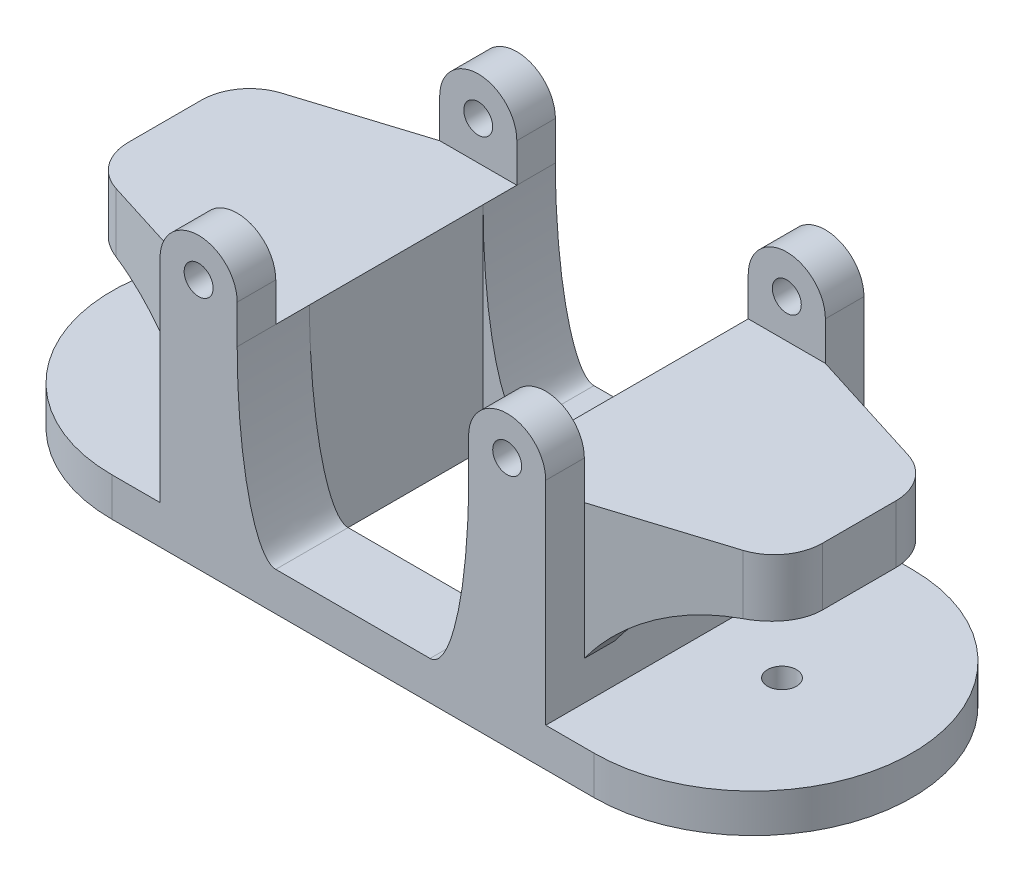
from build123d import *

# Parameters (mm, degrees)
SKETCH1_W                      = 32
SKETCH1_H                      = 33
BOSS_EXTRUDE1_DEPTH            = 18
SHELL1_T                       = -4
SKETCH2_R                      = 1.5
BOSS_EXTRUDE2_DEPTH            = 16.5
CUT_EXTRUDE5_REACH             = 46.41
SKETCH10_W                     = 25
SKETCH10_H                     = 8
CUT_EXTRUDE5_DIRECTION_2_REACH = 46.41
BOSS_EXTRUDE3_DEPTH            = 14
CUT_EXTRUDE6_DEPTH             = 10
CUT_EXTRUDE7_REACH             = 57.326
SKETCH15_R                     = 1.5
BOSS_EXTRUDE5_DEPTH            = 4
SKETCH9_W                      = 24
SKETCH9_H                      = 18
CUT_EXTRUDE4_DEPTH             = 50.784535752
SKETCH16_W                     = 24
SKETCH16_H                     = 18
CUT_EXTRUDE8_DEPTH             = 60.052942348
FILLET1_SIZE                   = 4
FILLET1_SIZE_2                 = 18
FILLET2_SIZE                   = 4
FILLET2_SIZE_2                 = 18


with BuildPart() as part:
    # Sketch1 → Boss-Extrude1 (new body)
    with BuildSketch(Plane(origin=(0, 0, 0), x_dir=(1, 0, 0), z_dir=(0, 1, 0))):
        Rectangle(SKETCH1_W, SKETCH1_H)
    extrude(amount=BOSS_EXTRUDE1_DEPTH)

    # Shell1
    shell1_openings = [part.faces().sort_by_distance(p)[0] for p in [
        (0, 18, 0),
    ]]
    offset(amount=SHELL1_T, openings=shell1_openings, kind=Kind.INTERSECTION)

    # Sketch2 → Boss-Extrude2 (add, symmetric)
    # profile 1 of 2: a face of its own
    with BuildSketch(Plane.XY):
        with BuildLine():
            Line((-16, 0), (-20, 0))
            Line((-20, 0), (-20, 22))
            ThreePointArc((-20, 22), (-16, 26), (-12, 22))
            Line((-12, 22), (-12, 18))
            Line((-12, 18), (-16, 18))
            Line((-16, 18), (-16, 0))
        make_face()
        with Locations((-16, 22)):
            Circle(SKETCH2_R, mode=Mode.SUBTRACT)
    # profile 2 of 2: a face of its own
    with BuildSketch(Plane.XY):
        with BuildLine():
            Line((16, 18), (16, 0))
            Line((16, 0), (20, 0))
            Line((20, 0), (20, 22))
            ThreePointArc((20, 22), (16, 26), (12, 22))
            Line((12, 22), (12, 18))
            Line((12, 18), (16, 18))
        make_face()
        with Locations(Location((16, 22, 0), (0, 0, 180))):
            Circle(SKETCH2_R, mode=Mode.SUBTRACT)
    extrude(amount=BOSS_EXTRUDE2_DEPTH, both=True)

    # Sketch10 → Cut-Extrude5 (cut, up to next)
    with BuildSketch(Plane(origin=(-12, 0, 0), x_dir=(0, 0, -1), z_dir=(1, 0, 0)), mode=Mode.PRIVATE) as cut_extrude5_sk1:
        with Locations((0, 22)):
            Rectangle(SKETCH10_W, SKETCH10_H)
    cut_extrude5_tool1 = extrude(cut_extrude5_sk1.sketch, amount=-CUT_EXTRUDE5_REACH, mode=Mode.PRIVATE) & part.part
    add(cut_extrude5_tool1.solids().sort_by_distance((-12, 22, 0))[0], mode=Mode.SUBTRACT)

    # Sketch10 → Cut-Extrude5 direction 2 (cut, up to next)
    with BuildSketch(Plane(origin=(-12, 0, 0), x_dir=(0, 0, -1), z_dir=(1, 0, 0)), mode=Mode.PRIVATE) as cut_extrude5_direction_2_sk1:
        with Locations((0, 22)):
            Rectangle(SKETCH10_W, SKETCH10_H)
    cut_extrude5_direction_2_tool1 = extrude(cut_extrude5_direction_2_sk1.sketch, amount=CUT_EXTRUDE5_DIRECTION_2_REACH, mode=Mode.PRIVATE) & part.part
    add(cut_extrude5_direction_2_tool1.solids().sort_by_distance((-12, 22, 0))[0], mode=Mode.SUBTRACT)

    # Sketch11 → Boss-Extrude3 (add)
    with BuildSketch(Plane(origin=(0, 18, 0), x_dir=(1, 0, 0), z_dir=(0, 1, 0))):
        with BuildLine():
            Line((-20, 12.5), (-32.5, 8.568931862))
            ThreePointArc((-32.5, 8.568931862), (-35.031128874, 6.757275747), (-36, 3.799235855))
            Line((-36, 3.799235855), (-36, -3.799235855))
            ThreePointArc((-36, -3.799235855), (-35.031128874, -6.757275747), (-32.5, -8.568931862))
            Line((-32.5, -8.568931862), (-20, -12.5))
            Line((-20, -12.5), (-20, 12.5))
        make_face()
        with BuildLine():
            Line((32.5, -8.568931862), (20, -12.5))
            Line((20, -12.5), (20, 12.5))
            Line((20, 12.5), (32.5, 8.568931862))
            ThreePointArc((32.5, 8.568931862), (35.031128874, 6.757275747), (36, 3.799235855))
            Line((36, 3.799235855), (36, -3.799235855))
            ThreePointArc((36, -3.799235855), (35.031128874, -6.757275747), (32.5, -8.568931862))
        make_face()
    extrude(amount=-BOSS_EXTRUDE3_DEPTH)

    # Sketch12 → Cut-Extrude6 (cut)
    with BuildSketch(Plane.XZ.offset(-4)):
        with BuildLine():
            Line((-20, -9.35514549), (-20, 9.35514549))
            Line((-20, 9.35514549), (-31.6, 5.707114258))
            ThreePointArc((-31.6, 5.707114258), (-32.61245155, 4.982451812), (-33, 3.799235855))
            Line((-33, 3.799235855), (-33, -3.799235855))
            ThreePointArc((-33, -3.799235855), (-32.61245155, -4.982451812), (-31.6, -5.707114258))
            Line((-31.6, -5.707114258), (-20, -9.35514549))
        make_face()
        with BuildLine():
            Line((31.6, -5.707114258), (20, -9.35514549))
            Line((20, -9.35514549), (20, 9.35514549))
            Line((20, 9.35514549), (31.6, 5.707114258))
            ThreePointArc((31.6, 5.707114258), (32.61245155, 4.982451812), (33, 3.799235855))
            Line((33, 3.799235855), (33, -3.799235855))
            ThreePointArc((33, -3.799235855), (32.61245155, -4.982451812), (31.6, -5.707114258))
        make_face()
    extrude(amount=-CUT_EXTRUDE6_DEPTH, mode=Mode.SUBTRACT)

    # Sketch13 → Cut-Extrude7 (cut, up to next)
    with BuildSketch(Plane.XY.offset(16.5), mode=Mode.PRIVATE) as cut_extrude7_sk1:
        with BuildLine():
            Line((-36, 12), (-36, 4))
            Line((-36, 4), (-20, 4))
            ThreePointArc((-20, 4), (-26.93585496, 10.128290081), (-36, 12))
        make_face()
    cut_extrude7_tool1 = extrude(cut_extrude7_sk1.sketch, amount=-CUT_EXTRUDE7_REACH, mode=Mode.PRIVATE) & part.part
    # Sketch13 → Cut-Extrude7 (cut, up to next)
    with BuildSketch(Plane.XY.offset(16.5), mode=Mode.PRIVATE) as cut_extrude7_sk2:
        with BuildLine():
            Line((36, 4), (20, 4))
            ThreePointArc((20, 4), (26.93585496, 10.128290081), (36, 12))
            Line((36, 12), (36, 4))
        make_face()
    cut_extrude7_tool2 = extrude(cut_extrude7_sk2.sketch, amount=-CUT_EXTRUDE7_REACH, mode=Mode.PRIVATE) & part.part
    add(cut_extrude7_tool1.solids().sort_by_distance((-29.706779, 7.345809, 16.5))[0], mode=Mode.SUBTRACT)
    add(cut_extrude7_tool2.solids().sort_by_distance((29.706779, 7.345809, 16.5))[0], mode=Mode.SUBTRACT)

    # Sketch15 → Boss-Extrude5 (add)
    with BuildSketch(Plane.XZ):
        with BuildLine():
            Line((-25, 16.5), (25, 16.5))
            ThreePointArc((25, 16.5), (41.5, 0), (25, -16.5))
            Line((25, -16.5), (-25, -16.5))
            ThreePointArc((-25, -16.5), (-41.5, 0), (-25, 16.5))
        make_face()
        with Locations(Location((-28, 0, 0), (0, 0, 270))):
            Circle(SKETCH15_R, mode=Mode.SUBTRACT)
        with Locations(Location((28, 0, 0), (0, 0, 90))):
            Circle(SKETCH15_R, mode=Mode.SUBTRACT)
    extrude(amount=BOSS_EXTRUDE5_DEPTH)

    # Sketch9 → Cut-Extrude4 (cut, through all)
    with BuildSketch(Plane(origin=(0, 4, 0), x_dir=(1, 0, 0), z_dir=(0, 1, 0))):
        Rectangle(SKETCH9_W, SKETCH9_H)
    extrude(amount=-CUT_EXTRUDE4_DEPTH, mode=Mode.SUBTRACT)

    # Sketch16 → Cut-Extrude8 (cut, through all)
    with BuildSketch(Plane.XY.offset(16.5)):
        with Locations((0, 9)):
            Rectangle(SKETCH16_W, SKETCH16_H)
    extrude(amount=-CUT_EXTRUDE8_DEPTH, mode=Mode.SUBTRACT)

    # Fillet1
    # an asymmetric fillet: 18, 4 mm, written as the material it adds along each edge
    with BuildSketch(Plane(origin=(-12, 0, 36), x_dir=(1, 0, 0), z_dir=(0, 0, -1))) as fillet1_piece_1_section:
        with BuildLine():
            Bezier((FILLET1_SIZE, 0), (0, 0), (0, -FILLET1_SIZE_2), weights=[1, 0.707106781, 1])
            Line((0, -FILLET1_SIZE_2), (0, 0))
            Line((0, 0), (FILLET1_SIZE, 0))
        make_face()
    fillet1_piece_1 = extrude(amount=52.5, mode=Mode.PRIVATE)
    fillet1_piece_1 = split(fillet1_piece_1, bisect_by=Plane(origin=(-11.340639328, 5.113051829, 12.5), z_dir=(0, 0, 1)), keep=Keep.TOP, mode=Mode.PRIVATE)
    fillet1_piece_1 = split(fillet1_piece_1, bisect_by=Plane(origin=(-11.340639328, 5.113051829, 16.5), z_dir=(0, 0, -1)), keep=Keep.TOP, mode=Mode.PRIVATE)
    add(fillet1_piece_1)
    with BuildSketch(Plane(origin=(-12, 0, 36), x_dir=(1, 0, 0), z_dir=(0, 0, -1))) as fillet1_piece_2_section:
        with BuildLine():
            Bezier((FILLET1_SIZE, 0), (0, 0), (0, -FILLET1_SIZE_2), weights=[1, 0.707106781, 1])
            Line((0, -FILLET1_SIZE_2), (0, 0))
            Line((0, 0), (FILLET1_SIZE, 0))
        make_face()
    fillet1_piece_2 = extrude(amount=52.5, mode=Mode.PRIVATE)
    fillet1_piece_2 = split(fillet1_piece_2, bisect_by=Plane(origin=(-11.340638818, 5.113050372, 12.5), z_dir=(0, 0, -1)), keep=Keep.TOP, mode=Mode.PRIVATE)
    fillet1_piece_2 = split(fillet1_piece_2, bisect_by=Plane(origin=(-11.340638818, 5.113050372, 9), z_dir=(0, 0, 1)), keep=Keep.TOP, mode=Mode.PRIVATE)
    add(fillet1_piece_2)
    with BuildSketch(Plane(origin=(-12, 0, -9), x_dir=(1, 0, 0), z_dir=(0, 0, -1))) as fillet1_piece_3_section:
        with BuildLine():
            Bezier((FILLET1_SIZE, 0), (0, 0), (0, -FILLET1_SIZE_2), weights=[1, 0.707106781, 1])
            Line((0, -FILLET1_SIZE_2), (0, 0))
            Line((0, 0), (FILLET1_SIZE, 0))
        make_face()
    fillet1_piece_3 = extrude(amount=7.5, mode=Mode.PRIVATE)
    fillet1_piece_3 = split(fillet1_piece_3, bisect_by=Plane(origin=(-11.340634928, 5.11305877, -12.5), z_dir=(0, 0, 1)), keep=Keep.TOP, mode=Mode.PRIVATE)
    add(fillet1_piece_3)
    with BuildSketch(Plane(origin=(-12, 0, -9), x_dir=(1, 0, 0), z_dir=(0, 0, -1))) as fillet1_piece_4_section:
        with BuildLine():
            Bezier((FILLET1_SIZE, 0), (0, 0), (0, -FILLET1_SIZE_2), weights=[1, 0.707106781, 1])
            Line((0, -FILLET1_SIZE_2), (0, 0))
            Line((0, 0), (FILLET1_SIZE, 0))
        make_face()
    fillet1_piece_4 = extrude(amount=7.5, mode=Mode.PRIVATE)
    fillet1_piece_4 = split(fillet1_piece_4, bisect_by=Plane(origin=(-11.340634418, 5.113057313, -12.5), z_dir=(0, 0, -1)), keep=Keep.TOP, mode=Mode.PRIVATE)
    add(fillet1_piece_4)
    with BuildSketch(Plane(origin=(-12, 0, 16.5), x_dir=(1, 0, 0), z_dir=(0, 0, -1))) as fillet1_piece_5_section:
        with BuildLine():
            Bezier((FILLET1_SIZE, 0), (0, 0), (0, -FILLET1_SIZE_2), weights=[1, 0.707106781, 1])
            Line((0, -FILLET1_SIZE_2), (0, 0))
            Line((0, 0), (FILLET1_SIZE, 0))
        make_face()
    fillet1_piece_5 = extrude(amount=7.5, mode=Mode.PRIVATE)
    fillet1_piece_5 = split(fillet1_piece_5, bisect_by=Plane(origin=(-11.340639328, 5.113051829, 12.5), z_dir=(0, 0, 1)), keep=Keep.TOP, mode=Mode.PRIVATE)
    add(fillet1_piece_5)
    with BuildSketch(Plane(origin=(-12, 0, 16.5), x_dir=(1, 0, 0), z_dir=(0, 0, -1))) as fillet1_piece_6_section:
        with BuildLine():
            Bezier((FILLET1_SIZE, 0), (0, 0), (0, -FILLET1_SIZE_2), weights=[1, 0.707106781, 1])
            Line((0, -FILLET1_SIZE_2), (0, 0))
            Line((0, 0), (FILLET1_SIZE, 0))
        make_face()
    fillet1_piece_6 = extrude(amount=7.5, mode=Mode.PRIVATE)
    fillet1_piece_6 = split(fillet1_piece_6, bisect_by=Plane(origin=(-11.340638818, 5.113050372, 12.5), z_dir=(0, 0, -1)), keep=Keep.TOP, mode=Mode.PRIVATE)
    add(fillet1_piece_6)
    with BuildSketch(Plane(origin=(-12, 0, 16.5), x_dir=(1, 0, 0), z_dir=(0, 0, -1))) as fillet1_piece_7_section:
        with BuildLine():
            Bezier((FILLET1_SIZE, 0), (0, 0), (0, -FILLET1_SIZE_2), weights=[1, 0.707106781, 1])
            Line((0, -FILLET1_SIZE_2), (0, 0))
            Line((0, 0), (FILLET1_SIZE, 0))
        make_face()
    fillet1_piece_7 = extrude(amount=52.5, mode=Mode.PRIVATE)
    fillet1_piece_7 = split(fillet1_piece_7, bisect_by=Plane(origin=(-11.340634928, 5.11305877, -12.5), z_dir=(0, 0, 1)), keep=Keep.TOP, mode=Mode.PRIVATE)
    fillet1_piece_7 = split(fillet1_piece_7, bisect_by=Plane(origin=(-11.340634928, 5.11305877, -9), z_dir=(0, 0, -1)), keep=Keep.TOP, mode=Mode.PRIVATE)
    add(fillet1_piece_7)
    with BuildSketch(Plane(origin=(-12, 0, 16.5), x_dir=(1, 0, 0), z_dir=(0, 0, -1))) as fillet1_piece_8_section:
        with BuildLine():
            Bezier((FILLET1_SIZE, 0), (0, 0), (0, -FILLET1_SIZE_2), weights=[1, 0.707106781, 1])
            Line((0, -FILLET1_SIZE_2), (0, 0))
            Line((0, 0), (FILLET1_SIZE, 0))
        make_face()
    fillet1_piece_8 = extrude(amount=52.5, mode=Mode.PRIVATE)
    fillet1_piece_8 = split(fillet1_piece_8, bisect_by=Plane(origin=(-11.340634418, 5.113057313, -16.5), z_dir=(0, 0, 1)), keep=Keep.TOP, mode=Mode.PRIVATE)
    fillet1_piece_8 = split(fillet1_piece_8, bisect_by=Plane(origin=(-11.340634418, 5.113057313, -12.5), z_dir=(0, 0, -1)), keep=Keep.TOP, mode=Mode.PRIVATE)
    add(fillet1_piece_8)

    # Fillet2
    # an asymmetric fillet: 18, 4 mm, written as the material it adds along each edge
    with BuildSketch(Plane(origin=(12, 0, 36), x_dir=(-1, 0, 0), z_dir=(0, 0, -1))) as fillet2_piece_1_section:
        with BuildLine():
            Bezier((FILLET2_SIZE, 0), (0, 0), (0, FILLET2_SIZE_2), weights=[1, 0.707106781, 1])
            Line((0, FILLET2_SIZE_2), (0, 0))
            Line((0, 0), (FILLET2_SIZE, 0))
        make_face()
    fillet2_piece_1 = extrude(amount=52.5, mode=Mode.PRIVATE)
    fillet2_piece_1 = split(fillet2_piece_1, bisect_by=Plane(origin=(11.340639328, 5.113051829, 16.5), z_dir=(0, 0, -1)), keep=Keep.TOP, mode=Mode.PRIVATE)
    fillet2_piece_1 = split(fillet2_piece_1, bisect_by=Plane(origin=(11.340639328, 5.113051829, 12.5), z_dir=(0, 0, 1)), keep=Keep.TOP, mode=Mode.PRIVATE)
    add(fillet2_piece_1)
    with BuildSketch(Plane(origin=(12, 0, 36), x_dir=(-1, 0, 0), z_dir=(0, 0, -1))) as fillet2_piece_2_section:
        with BuildLine():
            Bezier((FILLET2_SIZE, 0), (0, 0), (0, FILLET2_SIZE_2), weights=[1, 0.707106781, 1])
            Line((0, FILLET2_SIZE_2), (0, 0))
            Line((0, 0), (FILLET2_SIZE, 0))
        make_face()
    fillet2_piece_2 = extrude(amount=52.5, mode=Mode.PRIVATE)
    fillet2_piece_2 = split(fillet2_piece_2, bisect_by=Plane(origin=(11.340638818, 5.113050372, 12.5), z_dir=(0, 0, -1)), keep=Keep.TOP, mode=Mode.PRIVATE)
    fillet2_piece_2 = split(fillet2_piece_2, bisect_by=Plane(origin=(11.340638818, 5.113050372, 9), z_dir=(0, 0, 1)), keep=Keep.TOP, mode=Mode.PRIVATE)
    add(fillet2_piece_2)
    with BuildSketch(Plane(origin=(12, 0, -9), x_dir=(-1, 0, 0), z_dir=(0, 0, -1))) as fillet2_piece_3_section:
        with BuildLine():
            Bezier((FILLET2_SIZE, 0), (0, 0), (0, FILLET2_SIZE_2), weights=[1, 0.707106781, 1])
            Line((0, FILLET2_SIZE_2), (0, 0))
            Line((0, 0), (FILLET2_SIZE, 0))
        make_face()
    fillet2_piece_3 = extrude(amount=7.5, mode=Mode.PRIVATE)
    fillet2_piece_3 = split(fillet2_piece_3, bisect_by=Plane(origin=(11.340634928, 5.11305877, -12.5), z_dir=(0, 0, 1)), keep=Keep.TOP, mode=Mode.PRIVATE)
    add(fillet2_piece_3)
    with BuildSketch(Plane(origin=(12, 0, -9), x_dir=(-1, 0, 0), z_dir=(0, 0, -1))) as fillet2_piece_4_section:
        with BuildLine():
            Bezier((FILLET2_SIZE, 0), (0, 0), (0, FILLET2_SIZE_2), weights=[1, 0.707106781, 1])
            Line((0, FILLET2_SIZE_2), (0, 0))
            Line((0, 0), (FILLET2_SIZE, 0))
        make_face()
    fillet2_piece_4 = extrude(amount=7.5, mode=Mode.PRIVATE)
    fillet2_piece_4 = split(fillet2_piece_4, bisect_by=Plane(origin=(11.340634928, 5.11305877, -12.5), z_dir=(0, 0, -1)), keep=Keep.TOP, mode=Mode.PRIVATE)
    add(fillet2_piece_4)
    with BuildSketch(Plane(origin=(12, 0, 16.5), x_dir=(0, 1, 0), z_dir=(0, 0, -1))) as fillet2_piece_5_section:
        with BuildLine():
            Bezier((FILLET2_SIZE_2, 0), (0, 0), (0, -FILLET2_SIZE), weights=[1, 0.707106781, 1])
            Line((0, -FILLET2_SIZE), (0, 0))
            Line((0, 0), (FILLET2_SIZE_2, 0))
        make_face()
    fillet2_piece_5 = extrude(amount=7.5, mode=Mode.PRIVATE)
    fillet2_piece_5 = split(fillet2_piece_5, bisect_by=Plane(origin=(11.340638125, 5.113048077, 12.5), z_dir=(0, 0, 1)), keep=Keep.TOP, mode=Mode.PRIVATE)
    add(fillet2_piece_5)
    with BuildSketch(Plane(origin=(12, 0, 16.5), x_dir=(0, 1, 0), z_dir=(0, 0, -1))) as fillet2_piece_6_section:
        with BuildLine():
            Bezier((FILLET2_SIZE_2, 0), (0, 0), (0, -FILLET2_SIZE), weights=[1, 0.707106781, 1])
            Line((0, -FILLET2_SIZE), (0, 0))
            Line((0, 0), (FILLET2_SIZE_2, 0))
        make_face()
    fillet2_piece_6 = extrude(amount=7.5, mode=Mode.PRIVATE)
    fillet2_piece_6 = split(fillet2_piece_6, bisect_by=Plane(origin=(11.34063903, 5.113050451, 12.5), z_dir=(0, 0, -1)), keep=Keep.TOP, mode=Mode.PRIVATE)
    add(fillet2_piece_6)
    with BuildSketch(Plane(origin=(12, 0, 16.5), x_dir=(0, 1, 0), z_dir=(0, 0, -1))) as fillet2_piece_7_section:
        with BuildLine():
            Bezier((FILLET2_SIZE_2, 0), (0, 0), (0, -FILLET2_SIZE), weights=[1, 0.707106781, 1])
            Line((0, -FILLET2_SIZE), (0, 0))
            Line((0, 0), (FILLET2_SIZE_2, 0))
        make_face()
    fillet2_piece_7 = extrude(amount=52.5, mode=Mode.PRIVATE)
    fillet2_piece_7 = split(fillet2_piece_7, bisect_by=Plane(origin=(11.340644798, 5.113037249, -9), z_dir=(0, 0, -1)), keep=Keep.TOP, mode=Mode.PRIVATE)
    fillet2_piece_7 = split(fillet2_piece_7, bisect_by=Plane(origin=(11.340644798, 5.113037249, -12.5), z_dir=(0, 0, 1)), keep=Keep.TOP, mode=Mode.PRIVATE)
    add(fillet2_piece_7)
    with BuildSketch(Plane(origin=(12, 0, 16.5), x_dir=(0, 1, 0), z_dir=(0, 0, -1))) as fillet2_piece_8_section:
        with BuildLine():
            Bezier((FILLET2_SIZE_2, 0), (0, 0), (0, -FILLET2_SIZE), weights=[1, 0.707106781, 1])
            Line((0, -FILLET2_SIZE), (0, 0))
            Line((0, 0), (FILLET2_SIZE_2, 0))
        make_face()
    fillet2_piece_8 = extrude(amount=52.5, mode=Mode.PRIVATE)
    fillet2_piece_8 = split(fillet2_piece_8, bisect_by=Plane(origin=(11.340644798, 5.113037249, -16.5), z_dir=(0, 0, 1)), keep=Keep.TOP, mode=Mode.PRIVATE)
    fillet2_piece_8 = split(fillet2_piece_8, bisect_by=Plane(origin=(11.340644798, 5.113037249, -12.5), z_dir=(0, 0, -1)), keep=Keep.TOP, mode=Mode.PRIVATE)
    add(fillet2_piece_8)


solid = part.part
